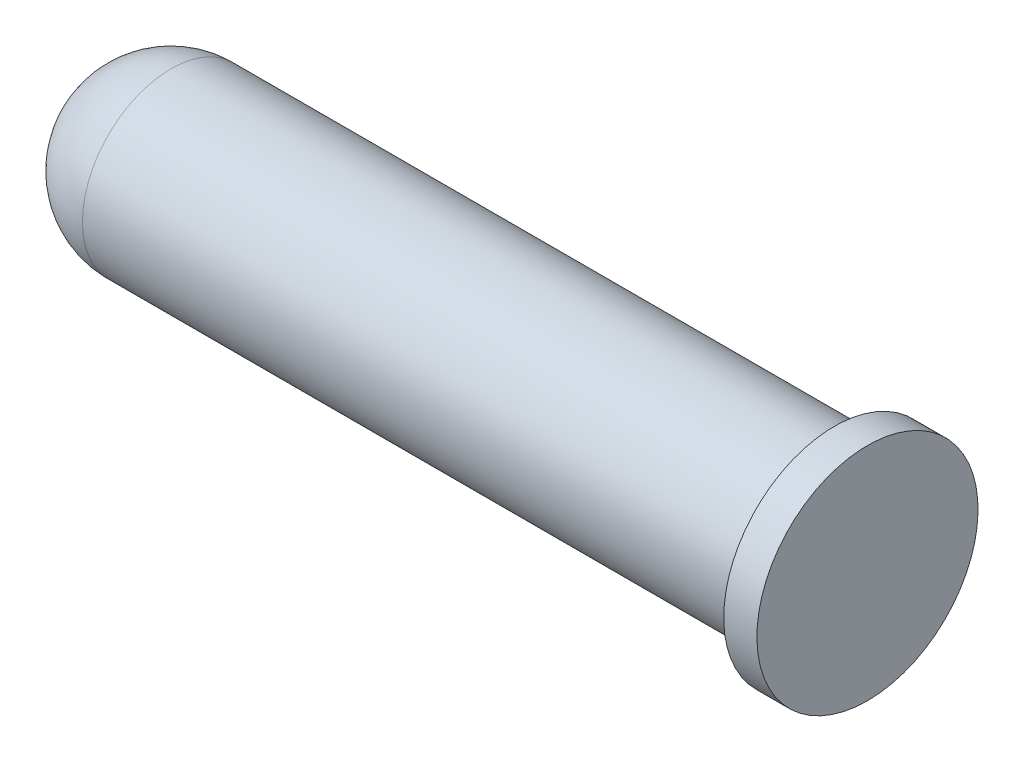
from build123d import *


with BuildPart() as part:
    # Sketch1 → Revolve1 (revolve)
    with BuildSketch(Plane.XY):
        with BuildLine():
            Line((-50.597839539, 75.144360912), (549.402160461, 75.144360912))
            Line((549.402160461, 75.144360912), (549.402160461, 95.144360912))
            Line((549.402160461, 95.144360912), (579.402160461, 95.144360912))
            Line((579.402160461, 95.144360912), (579.402160461, 65.144360912))
            Line((579.402160461, 65.144360912), (579.402160461, -4.855639088))
            Line((579.402160461, -4.855639088), (-50.597839539, -4.855639088))
            Line((-50.597839539, -4.855639088), (-130.597839539, -4.855639088))
            ThreePointArc((-130.597839539, -4.855639088), (-107.166382034, 51.712903407), (-50.597839539, 75.144360912))
        make_face()
    revolve(axis=Axis((-50.597839539, -4.855639088, 0), (1, 0, 0)))


solid = part.part
